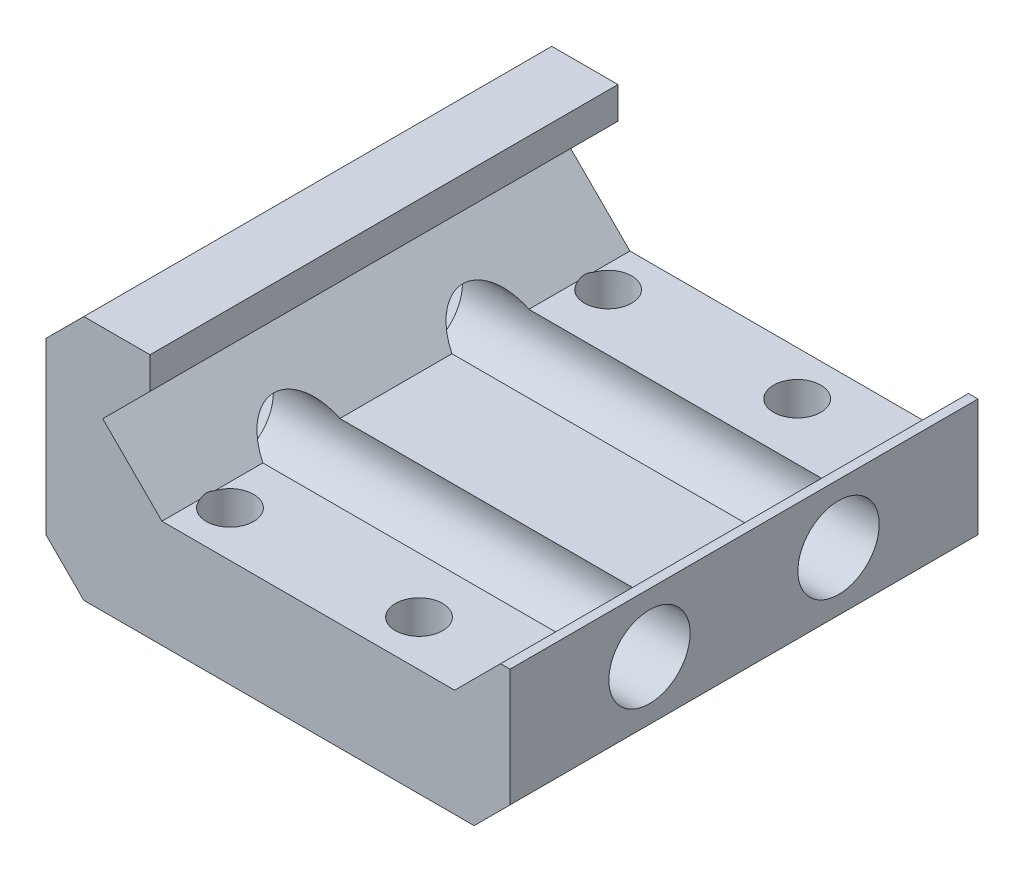
from build123d import *

# Parameters (mm, degrees)
DODANIE_WYCI_GNI_CIE3_DEPTH = 24.75
SZKIC3_R                    = 2.15
WYTNIJ_WYCI_GNI_CIE1_DEPTH  = 36.952280873
CUT_EXTRUDE1_DEPTH          = 34.975380793
CHAMFER1_SIZE               = 2
F_2_5_2_5_DIAMETER_HOLE1_D  = 2.5
CUT_EXTRUDE2_DEPTH          = 2.5


with BuildPart() as part:
    # Szkic1 → Dodanie-wyciągnięcie3 (new body)
    with BuildSketch(Plane.XY):
        Polygon((-3, 4.18), (2.5, 4.18), (2.5, 2.5), (0, 0), (3.13, -3.13), (18.61, -3.13), (21.54, -0.2), (21.54, -6.92), (19.64, -8.82), (-3, -8.82), align=None)
    extrude(amount=DODANIE_WYCI_GNI_CIE3_DEPTH)

    # Szkic3 → Wytnij-wyciągnięcie1 (cut, through all)
    with BuildSketch(Plane(origin=(21.54, 0, 0), x_dir=(0, 0, -1), z_dir=(1, 0, 0))):
        with Locations((-17.375, -3.82)):
            Circle(SZKIC3_R)
        with Locations((-7.375, -3.82)):
            Circle(SZKIC3_R)
    extrude(amount=-WYTNIJ_WYCI_GNI_CIE1_DEPTH, mode=Mode.SUBTRACT)

    # Sketch1 → Cut-Extrude1 (cut, through all)
    with BuildSketch(Plane.XY.offset(24.75)):
        Polygon((21.04, -0.7), (21.54, -0.7), (21.54, -0.2), align=None)
    extrude(amount=-CUT_EXTRUDE1_DEPTH, mode=Mode.SUBTRACT)

    # Chamfer1
    chamfer1_edges = [part.edges().sort_by_distance(p)[0] for p in [
        (-3, 4.18, 12.375),
        (-3, -8.82, 12.375),
    ]]
    chamfer(chamfer1_edges, length=CHAMFER1_SIZE)

    # Ø2.5 (2.5) Diameter Hole1 (through all)
    with Locations(Plane(origin=(0, -8.82, 0), x_dir=(-1, 0, 0), z_dir=(0, -1, 0))):
        with Locations((-4.32, -2.341796682), (-14.32, -2.341796682), (-14.32, -22.341796682), (-4.32, -22.341796682)):
            Hole(F_2_5_2_5_DIAMETER_HOLE1_D / 2)

    # Sketch6 → Cut-Extrude2 (cut)
    with BuildSketch(Plane.ZY.offset(3)):
        Polygon((9.366858429, -7.27), (11.358716857, -3.82), (9.366858429, -0.37), (5.383141571, -0.37), (3.391283143, -3.82), (5.383141571, -7.27), align=None)
        Polygon((15.383141571, -7.27), (19.366858429, -7.27), (21.358716857, -3.82), (19.366858429, -0.37), (15.383141571, -0.37), (13.391283143, -3.82), align=None)
    extrude(amount=-CUT_EXTRUDE2_DEPTH, mode=Mode.SUBTRACT)


solid = part.part
